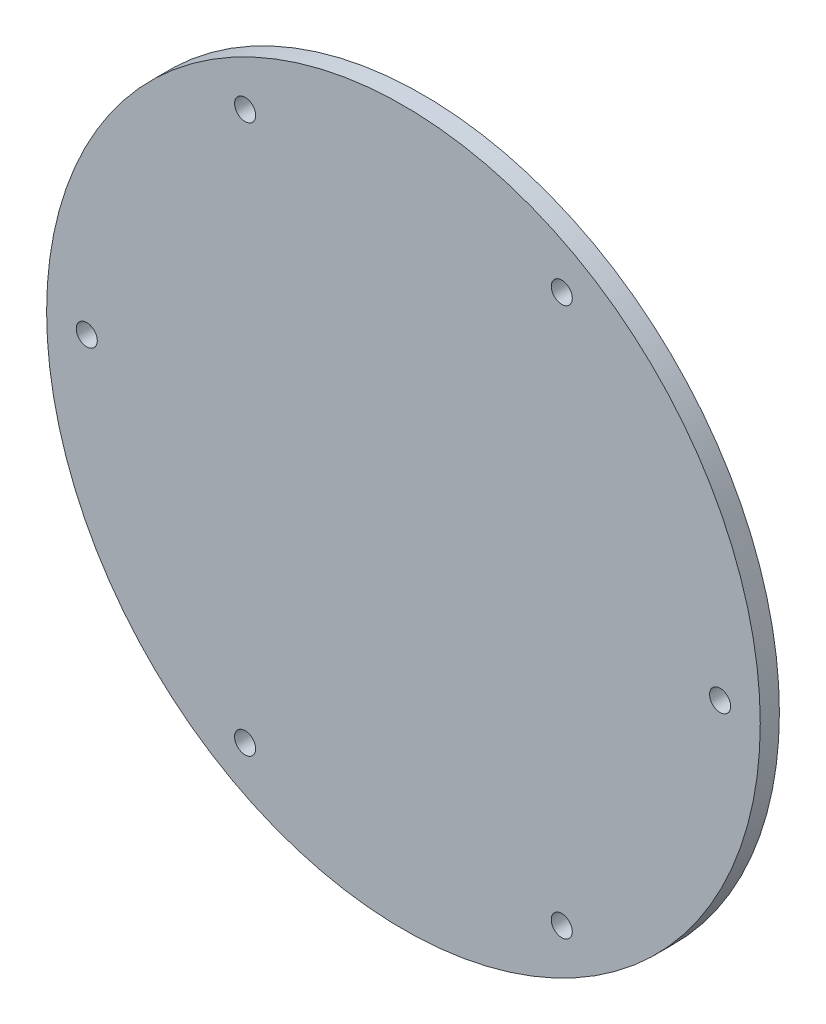
from build123d import *

# Parameters (mm, degrees)
SKETCH1_R           = 55.9705
SKETCH1_R_2         = 1.65
BOSS_EXTRUDE1_DEPTH = 3
SKETCH3_R           = 37.849999992
BOSS_EXTRUDE2_DEPTH = 2
BOSS_EXTRUDE2_TAPER = 2
CHAMFER1_SIZE       = 0.5
CHAMFER1_SIZE_2     = 0.518407978


with BuildPart() as part:
    # Sketch1 → Boss-Extrude1 (new body)
    with BuildSketch(Plane.XY):
        Circle(SKETCH1_R)
        with Locations((49.6705, 0)):
            Circle(SKETCH1_R_2, mode=Mode.SUBTRACT)
        with Locations((24.83525, 43.015914819)):
            Circle(SKETCH1_R_2, mode=Mode.SUBTRACT)
        with Locations((-24.83525, 43.015914819)):
            Circle(SKETCH1_R_2, mode=Mode.SUBTRACT)
        with Locations((-49.6705, 0)):
            Circle(SKETCH1_R_2, mode=Mode.SUBTRACT)
        with Locations((-24.83525, -43.015914819)):
            Circle(SKETCH1_R_2, mode=Mode.SUBTRACT)
        with Locations((24.83525, -43.015914819)):
            Circle(SKETCH1_R_2, mode=Mode.SUBTRACT)
    extrude(amount=BOSS_EXTRUDE1_DEPTH)

    # Sketch3 → Boss-Extrude2 (add)
    with BuildSketch(Plane(origin=(0, 0, 0), x_dir=(-1, 0, 0), z_dir=(0, 0, -1))):
        Circle(SKETCH3_R)
    extrude(amount=BOSS_EXTRUDE2_DEPTH, taper=BOSS_EXTRUDE2_TAPER)

    # Chamfer1
    # the kernel refuses this chamfer: 0.518407978, 0.5 mm, written as the material it takes off along each edge
    with BuildSketch(Plane(origin=(0, 0, -2), x_dir=(-1, 0, 0), z_dir=(0, 1, 0))) as chamfer1_piece_1:
        Polygon((37.780158453 + CHAMFER1_SIZE * 0.0348994967025, CHAMFER1_SIZE * 0.999390827019), (37.780158453 - CHAMFER1_SIZE_2, 0), (37.780158453, 0), align=None)
    revolve(axis=Axis((0, 0, -2), (0, 0, 1)), mode=Mode.SUBTRACT)


solid = part.part
